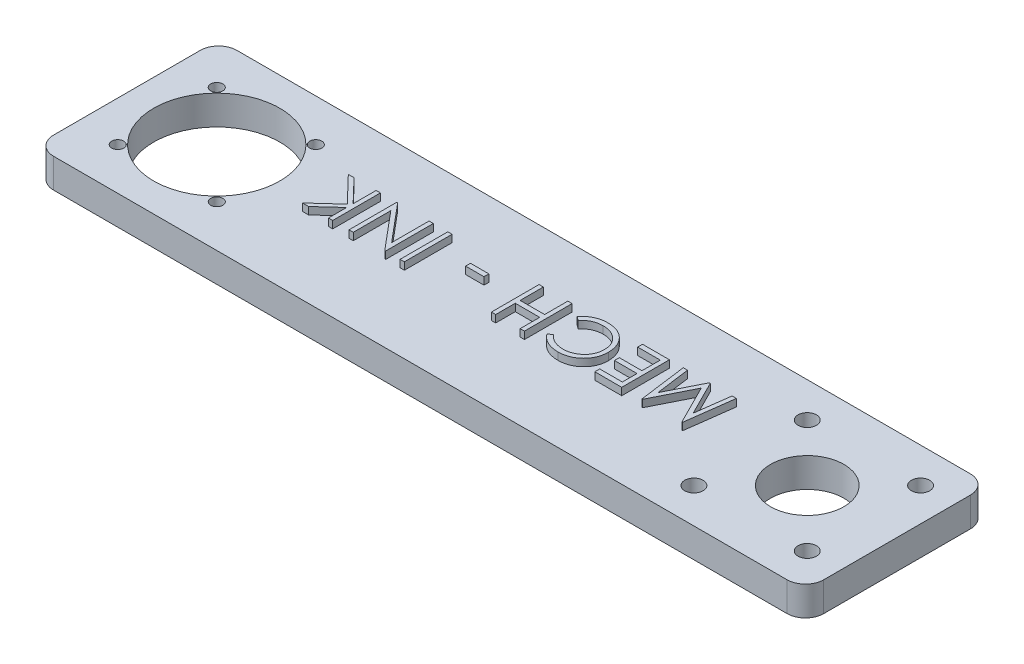
from build123d import *

# Parameters (mm, degrees)
CROQUIS1_W              = 210
CROQUIS1_H              = 50
CROQUIS1_R              = 17.2
CROQUIS1_R_2            = 10
CROQUIS1_R_3            = 2.5
CROQUIS1_R_4            = 1.65
SALIENTE_EXTRUIR1_DEPTH = 8
CROQUIS1_3_W            = 210
CROQUIS1_3_H            = 50
CROQUIS1_3_R            = 17.2
CROQUIS1_3_R_2          = 10
CROQUIS1_3_R_3          = 2.5
CROQUIS1_3_R_4          = 1.65
SALIENTE_EXTRUIR2_DEPTH = 8
CROQUIS1_4_W            = 210
CROQUIS1_4_H            = 50
CROQUIS1_4_R            = 1.65
CROQUIS1_4_R_2          = 17.2
CROQUIS1_4_R_3          = 2.5
CROQUIS1_4_R_4          = 10
SALIENTE_EXTRUIR3_DEPTH = 6
CROQUIS2_W              = 1.166666667
CROQUIS2_H              = 13
CROQUIS2_W_2            = 5
CROQUIS2_H_2            = 1.333333333
SALIENTE_EXTRUIR4_DEPTH = 2
REDONDEO1_R             = 5


with BuildPart() as part:
    # Croquis1 → Saliente-Extruir1 (new body)
    with BuildSketch(Plane(origin=(0, 0, 0), x_dir=(1, 0, 0), z_dir=(0, 1, 0))):
        Rectangle(CROQUIS1_W, CROQUIS1_H)
        with Locations((-80.5, 0)):
            Circle(CROQUIS1_R, mode=Mode.SUBTRACT)
        with Locations((80.5, 0)):
            Circle(CROQUIS1_R_2, mode=Mode.SUBTRACT)
        with Locations((95.95, -15.45)):
            Circle(CROQUIS1_R_3, mode=Mode.SUBTRACT)
        with Locations((95.95, 15.45)):
            Circle(CROQUIS1_R_3, mode=Mode.SUBTRACT)
        with Locations((65.05, 15.45)):
            Circle(CROQUIS1_R_3, mode=Mode.SUBTRACT)
        with Locations((65.05, -15.45)):
            Circle(CROQUIS1_R_3, mode=Mode.SUBTRACT)
        with Locations((-94, -13.5)):
            Circle(CROQUIS1_R_4, mode=Mode.SUBTRACT)
        with Locations((-67, -13.5)):
            Circle(CROQUIS1_R_4, mode=Mode.SUBTRACT)
        with Locations((-67, 13.5)):
            Circle(CROQUIS1_R_4, mode=Mode.SUBTRACT)
        with Locations((-94, 13.5)):
            Circle(CROQUIS1_R_4, mode=Mode.SUBTRACT)
    extrude(amount=SALIENTE_EXTRUIR1_DEPTH)

    # Croquis1<3> → Saliente-Extruir2 (add)
    with BuildSketch(Plane(origin=(0, 0, 0), x_dir=(1, 0, 0), z_dir=(0, 1, 0))):
        Rectangle(CROQUIS1_3_W, CROQUIS1_3_H)
        with Locations((-80.5, 0)):
            Circle(CROQUIS1_3_R, mode=Mode.SUBTRACT)
        with Locations((80.5, 0)):
            Circle(CROQUIS1_3_R_2, mode=Mode.SUBTRACT)
        with Locations((95.95, -15.45)):
            Circle(CROQUIS1_3_R_3, mode=Mode.SUBTRACT)
        with Locations((95.95, 15.45)):
            Circle(CROQUIS1_3_R_3, mode=Mode.SUBTRACT)
        with Locations((65.05, 15.45)):
            Circle(CROQUIS1_3_R_3, mode=Mode.SUBTRACT)
        with Locations((65.05, -15.45)):
            Circle(CROQUIS1_3_R_3, mode=Mode.SUBTRACT)
        with Locations((-94, -13.5)):
            Circle(CROQUIS1_3_R_4, mode=Mode.SUBTRACT)
        with Locations((-67, -13.5)):
            Circle(CROQUIS1_3_R_4, mode=Mode.SUBTRACT)
        with Locations((-67, 13.5)):
            Circle(CROQUIS1_3_R_4, mode=Mode.SUBTRACT)
        with Locations((-94, 13.5)):
            Circle(CROQUIS1_3_R_4, mode=Mode.SUBTRACT)
    extrude(amount=SALIENTE_EXTRUIR2_DEPTH)

    # Croquis1<4> → Saliente-Extruir3 (add)
    with BuildSketch(Plane(origin=(0, 0, 0), x_dir=(1, 0, 0), z_dir=(0, 1, 0))):
        Rectangle(CROQUIS1_4_W, CROQUIS1_4_H)
        with Locations((-94, -13.5)):
            Circle(CROQUIS1_4_R, mode=Mode.SUBTRACT)
        with Locations((-67, -13.5)):
            Circle(CROQUIS1_4_R, mode=Mode.SUBTRACT)
        with Locations((-80.5, 0)):
            Circle(CROQUIS1_4_R_2, mode=Mode.SUBTRACT)
        with Locations((65.05, -15.45)):
            Circle(CROQUIS1_4_R_3, mode=Mode.SUBTRACT)
        with Locations((95.95, -15.45)):
            Circle(CROQUIS1_4_R_3, mode=Mode.SUBTRACT)
        with Locations((80.5, 0)):
            Circle(CROQUIS1_4_R_4, mode=Mode.SUBTRACT)
        with Locations((-94, 13.5)):
            Circle(CROQUIS1_4_R, mode=Mode.SUBTRACT)
        with Locations((-67, 13.5)):
            Circle(CROQUIS1_4_R, mode=Mode.SUBTRACT)
        with Locations((65.05, 15.45)):
            Circle(CROQUIS1_4_R_3, mode=Mode.SUBTRACT)
        with Locations((95.95, 15.45)):
            Circle(CROQUIS1_4_R_3, mode=Mode.SUBTRACT)
    extrude(amount=SALIENTE_EXTRUIR3_DEPTH)

    # Croquis2 → Saliente-Extruir4 (add)
    with BuildSketch(Plane(origin=(0, 8, 0), x_dir=(1, 0, 0), z_dir=(0, 1, 0))):
        Polygon((-44.783333333, -4.094936845), (-45.95, -4.094936845), (-45.95, 0.855583989), (-51.369270833, -4.094936845), (-53.033333333, -4.094936845), (-46.6453125, 1.738396489), (-53.533333333, 8.905063155), (-51.976041667, 8.905063155), (-45.95, 2.631625655), (-45.95, 8.905063155), (-44.783333333, 8.905063155), align=None)
        Polygon((-30.35, 8.905063155), (-30.35, -4.094936845), (-30.594791667, -4.094936845), (-39.183333333, 6.136833989), (-39.183333333, -4.094936845), (-40.35, -4.094936845), (-40.35, 8.905063155), (-40.084375, 8.905063155), (-31.516666667, -1.303270178), (-31.516666667, 8.905063155), align=None)
        with Locations((-25.833333334, 2.405063155)):
            Rectangle(CROQUIS2_W, CROQUIS2_H)
        with Locations((-13.383333333, 3.905063156)):
            Rectangle(CROQUIS2_W_2, CROQUIS2_H_2)
        Polygon((7.483333333, -4.094936845), (6.316666667, -4.094936845), (6.316666667, 1.238396489), (-0.35, 1.238396489), (-0.35, -4.094936845), (-1.516666667, -4.094936845), (-1.516666667, 8.905063155), (-0.35, 8.905063155), (-0.35, 2.571729822), (6.316666667, 2.571729822), (6.316666667, 8.905063155), (7.483333333, 8.905063155), align=None)
        with BuildLine():
            Line((11.25, -1.709520178), (12.270833333, -0.928270178))
            add(Edge.make_bspline(
                [(12.270833333, -0.928270178), (12.343655951, -1.015056918), (12.48831938, -1.187460324), (12.721042589, -1.429572645), (12.96363259, -1.656323369), (13.21575185, -1.869169404), (13.483234992, -2.059556024), (13.755890155, -2.2423107), (14.043624109, -2.402318707), (14.439484744, -2.597788505), (14.959357186, -2.797313775), (15.611529457, -2.968922731), (16.293271069, -3.077135393), (16.758272949, -3.088935059), (16.994791667, -3.094936845)],
                knots=[0, 0, 0, 0, 0.75789156, 1.505565099, 2.245254514, 2.979266606, 3.711207489, 4.440978832, 5.174393176, 5.91211879, 7.394186119, 8.890401545, 10.418332761, 12, 12, 12, 12], degree=3))
            add(Edge.make_bspline(
                [(16.994791667, -3.094936845), (17.12509948, -3.093429642), (17.384505728, -3.090429226), (17.769509148, -3.051123819), (18.148052557, -2.99524337), (18.518728283, -2.914344816), (18.88080034, -2.809022244), (19.23702558, -2.685506964), (19.583208719, -2.531804792), (19.923515616, -2.362061046), (20.249538473, -2.170282623), (20.558073628, -1.961165095), (20.847729553, -1.736774289), (21.119242894, -1.497640472), (21.369877739, -1.240971925), (21.602296689, -0.96965247), (21.816203091, -0.682456811), (22.011376242, -0.380757184), (22.185946317, -0.066043893), (22.337326934, 0.260331229), (22.465287991, 0.597121343), (22.569098078, 0.943604667), (22.650344094, 1.298554734), (22.706583639, 1.66324246), (22.745526925, 2.037030387), (22.748500903, 2.290378487), (22.75, 2.418083989)],
                knots=[0, 0, 0, 0, 1.054960097, 2.100129169, 3.131228542, 4.15308236, 5.169990287, 6.183953224, 7.204064171, 8.235355279, 9.262684623, 10.264978336, 11.252191258, 12.228402777, 13.192898315, 14.155264692, 15.119862721, 16.091023151, 17.063429752, 18.032246104, 19.00241354, 19.978852882, 20.959535218, 21.948948728, 22.966123959, 24, 24, 24, 24], degree=3))
            add(Edge.make_bspline(
                [(22.75, 2.418083989), (22.745302254, 2.610224608), (22.736078853, 2.987467228), (22.654341045, 3.540104585), (22.529134737, 4.070039773), (22.34455687, 4.573684647), (22.112420917, 5.0552377), (21.822779255, 5.508859113), (21.486053832, 5.941194573), (21.098790278, 6.341773167), (20.673843153, 6.707676116), (20.217925317, 7.029893933), (19.732154317, 7.298491705), (19.221898474, 7.522002462), (18.683229993, 7.693813138), (18.117117885, 7.814765604), (17.524793327, 7.893665129), (17.120049843, 7.901218828), (16.9140625, 7.905063155)],
                knots=[0, 0, 0, 0, 1.029159485, 2.020618137, 2.987588728, 3.942669054, 4.889339625, 5.846988364, 6.821327795, 7.821533711, 8.827683044, 9.822769455, 10.807800696, 11.797391277, 12.803701919, 13.832062008, 14.896664671, 16, 16, 16, 16], degree=3))
            add(Edge.make_bspline(
                [(16.9140625, 7.905063155), (16.687109655, 7.898790545), (16.240412165, 7.886444547), (15.585330924, 7.78185305), (14.958226652, 7.612266498), (14.359065616, 7.374931358), (13.78953693, 7.066403146), (13.248749335, 6.692382458), (12.736246359, 6.249311508), (12.42806731, 5.911002746), (12.270833333, 5.738396489)],
                knots=[0, 0, 0, 0, 1.028121516, 2.023589091, 2.998037872, 3.967518031, 4.937445131, 5.927275754, 6.942489185, 8, 8, 8, 8], degree=3))
            Line((12.270833333, 5.738396489), (11.25, 6.511833989))
            add(Edge.make_bspline(
                [(11.25, 6.511833989), (11.332155751, 6.617830466), (11.496073732, 6.829315703), (11.761448116, 7.127519489), (12.04120307, 7.407769833), (12.33609381, 7.668607204), (12.646505293, 7.911335362), (12.972301851, 8.134825668), (13.311858523, 8.341557299), (13.665600488, 8.528935238), (14.033547109, 8.695670303), (14.412545163, 8.84139637), (14.803288905, 8.963761503), (15.202697002, 9.066573547), (15.614873364, 9.140000985), (16.035101977, 9.198437989), (16.467295429, 9.23311487), (16.758619208, 9.236620155), (16.90625, 9.238396489)],
                knots=[0, 0, 0, 0, 0.986880684, 1.969034265, 2.935876267, 3.899990983, 4.864973347, 5.834408638, 6.8063673, 7.789580233, 8.778939794, 9.778051223, 10.776304221, 11.791326552, 12.811423977, 13.855999788, 14.91350973, 16, 16, 16, 16], degree=3))
            add(Edge.make_bspline(
                [(16.90625, 9.238396489), (17.046069335, 9.237423373), (17.322544755, 9.235499159), (17.730740118, 9.204328251), (18.12812999, 9.161800657), (18.5135786, 9.097765884), (18.889189365, 9.022201193), (19.25155725, 8.920907954), (19.604248031, 8.807439621), (19.945844725, 8.674078241), (20.276637896, 8.523589563), (20.595560624, 8.35350663), (20.90246623, 8.165259704), (21.200372079, 7.962998237), (21.48487739, 7.740225402), (21.758447627, 7.500035045), (22.022616824, 7.243236719), (22.186055368, 7.05806155), (22.268229167, 6.964958989)],
                knots=[0, 0, 0, 0, 1.114604814, 2.203992996, 3.262667896, 4.300477797, 5.318619304, 6.316056647, 7.298880507, 8.271930387, 9.238335007, 10.195173496, 11.151986948, 12.108099108, 13.064862484, 14.031167946, 15.010108607, 16, 16, 16, 16], degree=3))
            add(Edge.make_bspline(
                [(22.268229167, 6.964958989), (22.399838686, 6.803231236), (22.66146882, 6.481728251), (22.996347756, 5.960715157), (23.282046576, 5.417217737), (23.515623212, 4.848087959), (23.695037319, 4.253104575), (23.821177099, 3.633224739), (23.902574906, 2.989687625), (23.911917679, 2.552014293), (23.916666667, 2.329542322)],
                knots=[0, 0, 0, 0, 0.994611881, 1.977215934, 2.950189954, 3.921972279, 4.908960509, 5.911694611, 6.938501887, 8, 8, 8, 8], degree=3))
            add(Edge.make_bspline(
                [(23.916666667, 2.329542322), (23.910864397, 2.095717563), (23.899448794, 1.635681948), (23.803261737, 0.960381919), (23.646650626, 0.314327725), (23.430996083, -0.304966495), (23.146490082, -0.893957374), (22.802072558, -1.45513247), (22.394379386, -1.988033568), (21.928530801, -2.485847477), (21.417539494, -2.940981517), (20.870362366, -3.34140773), (20.288027564, -3.674643382), (19.676961756, -3.953200781), (19.032586232, -4.167308726), (18.356276613, -4.317192008), (17.64930349, -4.410484149), (17.166957339, -4.422277779), (16.921875, -4.428270178)],
                knots=[0, 0, 0, 0, 1.032901378, 2.032168977, 3.007206631, 3.966850309, 4.924221947, 5.891988639, 6.871730993, 7.884084801, 8.900290346, 9.89161143, 10.874607481, 11.860025555, 12.854717796, 13.869097222, 14.917278314, 16, 16, 16, 16], degree=3))
            add(Edge.make_bspline(
                [(16.921875, -4.428270178), (16.772507159, -4.426479159), (16.47684856, -4.422934018), (16.039478702, -4.388371535), (15.613674872, -4.330737849), (15.198252539, -4.252192709), (14.792526491, -4.154497652), (14.398320091, -4.032170535), (14.016762851, -3.884268966), (13.645281922, -3.719658181), (13.288640313, -3.531134391), (12.947015427, -3.32621751), (12.623181191, -3.100961529), (12.315032528, -2.858651732), (12.023994102, -2.597424064), (11.745698026, -2.321669421), (11.488407521, -2.024072873), (11.329614646, -1.814563012), (11.25, -1.709520178)],
                knots=[0, 0, 0, 0, 1.096566765, 2.170543479, 3.218870886, 4.250164525, 5.273529809, 6.281496242, 7.278154839, 8.276706968, 9.263143576, 10.238168486, 11.199979644, 12.157579042, 13.114563119, 14.070017788, 15.032356758, 16, 16, 16, 16], degree=3))
        make_face()
        Polygon((34.016666667, -4.094936845), (26.683333333, -4.094936845), (26.683333333, -2.761603511), (32.85, -2.761603511), (32.85, 1.238396489), (26.683333333, 1.238396489), (26.683333333, 2.571729822), (32.85, 2.571729822), (32.85, 7.571729822), (26.683333333, 7.571729822), (26.683333333, 8.905063155), (34.016666667, 8.905063155), align=None)
        Polygon((52.283333333, 8.905063155), (50.5671875, -4.094936845), (50.400520833, -4.094936845), (45.033333333, 6.571729822), (39.681770833, -4.094936845), (39.515104167, -4.094936845), (37.783333333, 8.905063155), (38.95, 8.905063155), (40.2, -0.441291011), (44.890104167, 8.905063155), (45.155729167, 8.905063155), (49.866666667, -0.469936845), (51.108854167, 8.905063155), align=None)
    extrude(amount=SALIENTE_EXTRUIR4_DEPTH)

    # Redondeo1
    redondeo1_edges = [part.edges().sort_by_distance(p)[0] for p in [
        (105, 4, -25),
        (105, 4, 25),
        (-105, 4, 25),
        (-105, 4, -25),
    ]]
    fillet(redondeo1_edges, radius=REDONDEO1_R)


solid = part.part
